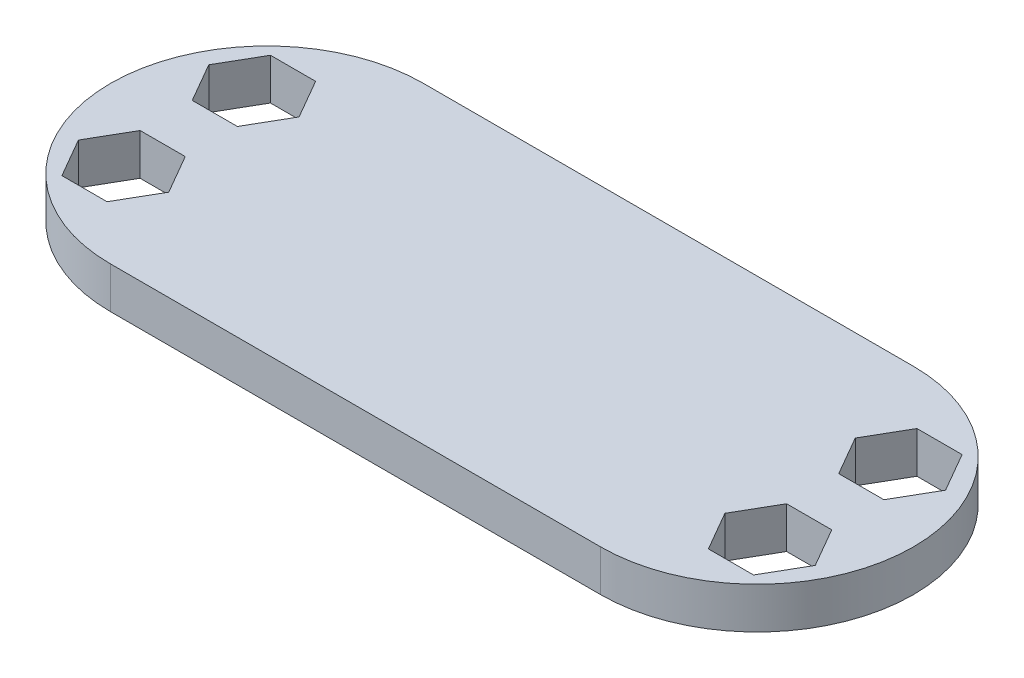
from build123d import *

# Parameters (mm, degrees)
BOSS_EXTRUDE1_DEPTH = 3.175


with BuildPart() as part:
    # Sketch2 → Boss-Extrude1 (new body)
    with BuildSketch(Plane(origin=(0, 0, 0), x_dir=(1, 0, 0), z_dir=(0, 1, 0))):
        with BuildLine():
            Line((-145.521414695, -2.002940607), (-107.921414695, -2.002940607))
            ThreePointArc((-107.921414695, -2.002940607), (-95.921414695, -14.002940607), (-107.921414695, -26.002940607))
            Line((-107.921414695, -26.002940607), (-145.521414695, -26.002940607))
            ThreePointArc((-145.521414695, -26.002940607), (-157.521414695, -14.002940607), (-145.521414695, -2.002940607))
        make_face()
        Polygon((-149.789363887, -12.002940607), (-148.05731308, -9.002940607), (-149.789363887, -6.002940607), (-153.253465503, -6.002940607), (-154.98551631, -9.002940607), (-153.253465503, -12.002940607), align=None, mode=Mode.SUBTRACT)
        Polygon((-153.253465503, -16.002940607), (-149.789363887, -16.002940607), (-148.05731308, -19.002940607), (-149.789363887, -22.002940607), (-153.253465503, -22.002940607), (-154.98551631, -19.002940607), align=None, mode=Mode.SUBTRACT)
        Polygon((-103.653465503, -16.002940607), (-105.38551631, -19.002940607), (-103.653465503, -22.002940607), (-100.189363887, -22.002940607), (-98.45731308, -19.002940607), (-100.189363887, -16.002940607), align=None, mode=Mode.SUBTRACT)
        Polygon((-100.189363887, -12.002940607), (-103.653465503, -12.002940607), (-105.38551631, -9.002940607), (-103.653465503, -6.002940607), (-100.189363887, -6.002940607), (-98.45731308, -9.002940607), align=None, mode=Mode.SUBTRACT)
    extrude(amount=BOSS_EXTRUDE1_DEPTH)


solid = part.part
